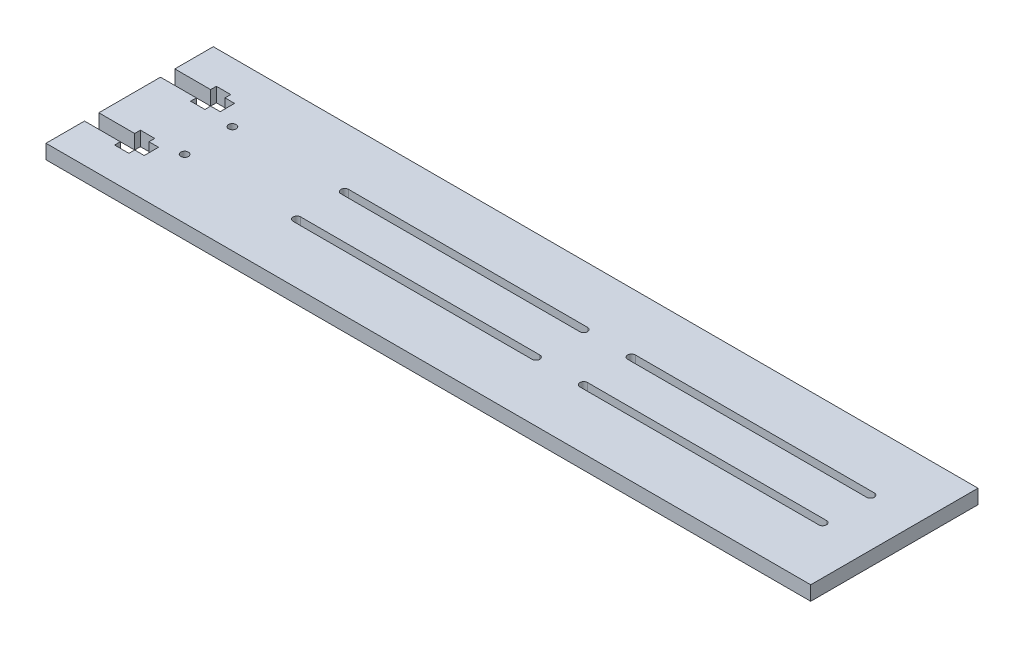
from build123d import *

# Parameters (mm, degrees)
SKETCH1_W           = 320
SKETCH1_H           = 70
BOSS_EXTRUDE1_DEPTH = 6
CUT_EXTRUDE2_DEPTH  = 164.893257946
CUT_EXTRUDE3_DEPTH  = 164.893257946
SKETCH6_R           = 1.6
CUT_EXTRUDE4_DEPTH  = 164.893257946


with BuildPart() as part:
    # Sketch1 → Boss-Extrude1 (new body)
    with BuildSketch(Plane(origin=(0, 0, 0), x_dir=(1, 0, 0), z_dir=(0, 1, 0))):
        Rectangle(SKETCH1_W, SKETCH1_H)
    extrude(amount=BOSS_EXTRUDE1_DEPTH)

    # Sketch3 → Cut-Extrude2 (cut, through all)
    with BuildSketch(Plane(origin=(0, 6, 0), x_dir=(1, 0, 0), z_dir=(0, 1, 0))):
        Polygon((-160, 12.9), (-145, 12.9), (-145, 10.5), (-139, 10.5), (-139, 12.9), (-135, 12.9), (-135, 18.9), (-139, 18.9), (-139, 21.3), (-145, 21.3), (-145, 18.9), (-160, 18.9), align=None)
        Polygon((-145, -18.9), (-145, -21.3), (-139, -21.3), (-139, -18.9), (-135, -18.9), (-135, -12.9), (-139, -12.9), (-139, -10.5), (-145, -10.5), (-145, -12.9), (-160, -12.9), (-160, -18.9), align=None)
    extrude(amount=-CUT_EXTRUDE2_DEPTH, mode=Mode.SUBTRACT)

    # Sketch5 → Cut-Extrude3 (cut, through all)
    with BuildSketch(Plane(origin=(0, 6, 0), x_dir=(1, 0, 0), z_dir=(0, 1, 0))):
        with BuildLine():
            Line((40, -8.4), (140, -8.4))
            ThreePointArc((140, -8.4), (141.6, -10), (140, -11.6))
            Line((140, -11.6), (40, -11.6))
            ThreePointArc((40, -11.6), (38.4, -10), (40, -8.4))
        make_face()
        with BuildLine():
            Line((-80, -8.4), (20, -8.4))
            ThreePointArc((20, -8.4), (21.6, -10), (20, -11.6))
            Line((20, -11.6), (-80, -11.6))
            ThreePointArc((-80, -11.6), (-81.6, -10), (-80, -8.4))
        make_face()
        with BuildLine():
            Line((-80, 11.6), (20, 11.6))
            ThreePointArc((20, 11.6), (21.6, 10), (20, 8.4))
            Line((20, 8.4), (-80, 8.4))
            ThreePointArc((-80, 8.4), (-81.6, 10), (-80, 11.6))
        make_face()
        with BuildLine():
            Line((40, 11.6), (140, 11.6))
            ThreePointArc((140, 11.6), (141.6, 10), (140, 8.4))
            Line((140, 8.4), (40, 8.4))
            ThreePointArc((40, 8.4), (38.4, 10), (40, 11.6))
        make_face()
    extrude(amount=-CUT_EXTRUDE3_DEPTH, mode=Mode.SUBTRACT)

    # Sketch6 → Cut-Extrude4 (cut, through all)
    with BuildSketch(Plane.XZ):
        with Locations((-127, -10)):
            Circle(SKETCH6_R)
        with Locations((-127, 10)):
            Circle(SKETCH6_R)
    extrude(amount=-CUT_EXTRUDE4_DEPTH, mode=Mode.SUBTRACT)


solid = part.part
